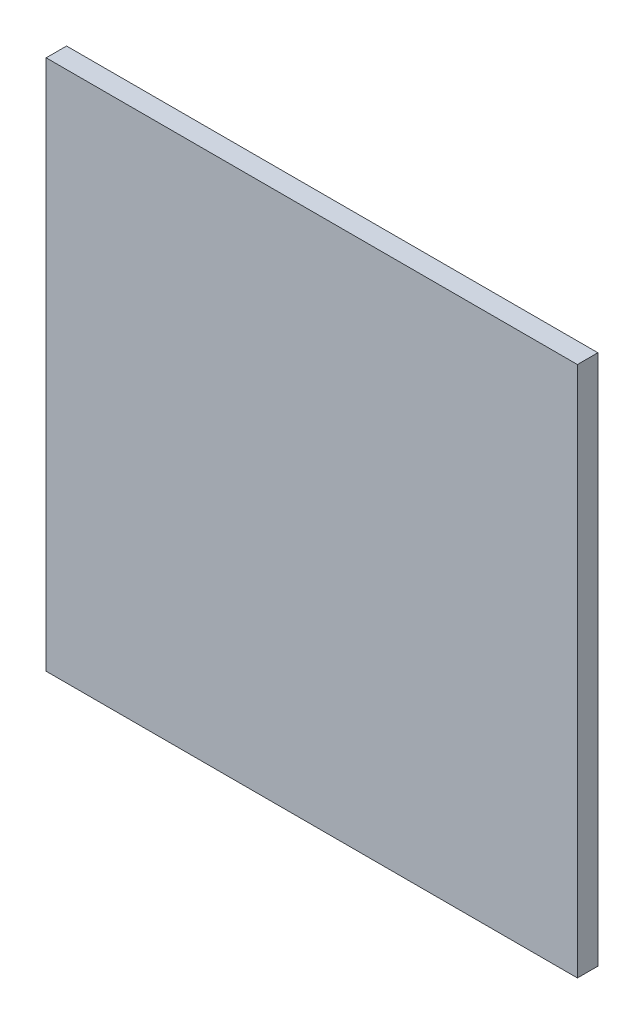
from build123d import *

# Parameters (mm, degrees)
ESQUISSE1_W        = 520
ESQUISSE1_H        = 520
BOSS_EXTRU_1_DEPTH = 20


with BuildPart() as part:
    # Esquisse1 → Boss.-Extru.1 (new body)
    with BuildSketch(Plane.XY):
        Rectangle(ESQUISSE1_W, ESQUISSE1_H)
    extrude(amount=BOSS_EXTRU_1_DEPTH)


solid = part.part
